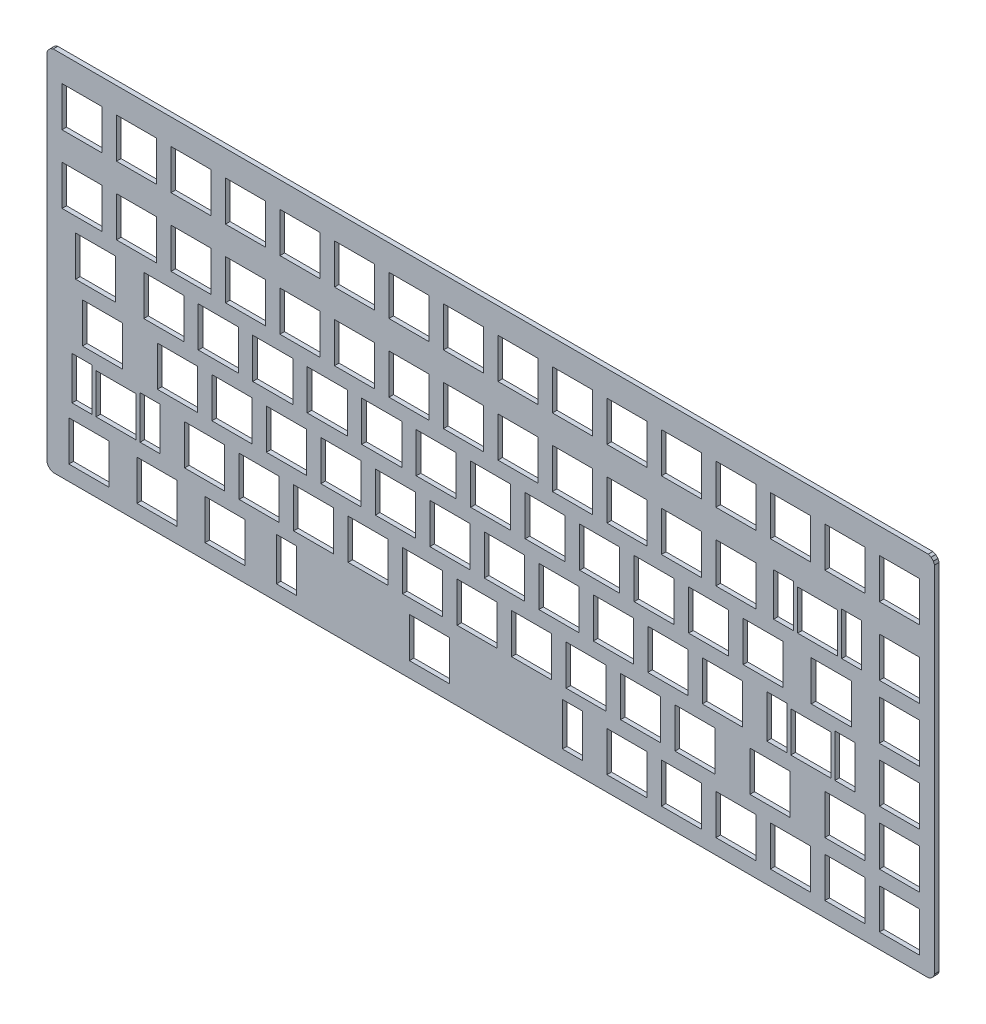
from build123d import *

# Parameters (mm, degrees)
BOSS_EXTRUDE1_DEPTH  = 1.6
SKETCH17_W           = 14
SKETCH17_H           = 14
CUT_EXTRUDE1_DEPTH   = 401.190052506
LPATTERN1_COUNT      = 16
LPATTERN1_PITCH      = 19.05
SKETCH18_W           = 14
SKETCH18_H           = 14
CUT_EXTRUDE2_DEPTH   = 401.190052506
LPATTERN2_COUNT      = 13
LPATTERN2_PITCH      = 19.05
LPATTERN3_COUNT      = 2
LPATTERN3_PITCH      = 257.175
SKETCH20_W           = 14
SKETCH20_H           = 14
CUT_EXTRUDE3_DEPTH   = 401.190052506
SKETCH22_W           = 14
SKETCH22_H           = 14
CUT_EXTRUDE4_DEPTH   = 401.190052506
LPATTERN4_COUNT      = 12
LPATTERN4_PITCH      = 19.05
SKETCH23_W           = 14
SKETCH23_H           = 14
CUT_EXTRUDE5_DEPTH   = 401.190052506
LPATTERN5_COUNT      = 11
LPATTERN5_PITCH      = 19.05
SKETCH24_W           = 14
SKETCH24_H           = 14
CUT_EXTRUDE6_DEPTH   = 401.190052506
LPATTERN6_COUNT      = 10
LPATTERN6_PITCH      = 19.05
SKETCH25_W           = 14
SKETCH25_H           = 14
CUT_EXTRUDE7_DEPTH   = 401.190052506
LPATTERN7_COUNT      = 3
LPATTERN7_PITCH      = 23.8125
SKETCH26_W           = 14
SKETCH26_H           = 14
CUT_EXTRUDE8_DEPTH   = 401.190052506
LPATTERN8_COUNT      = 2
LPATTERN8_PITCH      = 19.05
LPATTERN8_COUNT_DIR2 = 2
LPATTERN8_PITCH_DIR2 = 19.05
SKETCH27_W           = 14
SKETCH27_H           = 14
CUT_EXTRUDE9_DEPTH   = 401.190052506
LPATTERN9_COUNT      = 3
LPATTERN9_PITCH      = 19.05
SKETCH28_W           = 14
SKETCH28_H           = 14
CUT_EXTRUDE10_DEPTH  = 401.190052506
LPATTERN10_COUNT     = 4
LPATTERN10_PITCH     = 19.05
SKETCH29_W           = 14
SKETCH29_H           = 14
CUT_EXTRUDE11_DEPTH  = 401.190052506
LPATTERN11_COUNT     = 2
LPATTERN11_PITCH     = 257.175
SKETCH35_W           = 7
SKETCH35_H           = 15
CUT_EXTRUDE12_DEPTH  = 401.190052506
SKETCH37_W           = 14
SKETCH37_H           = 14
CUT_EXTRUDE13_DEPTH  = 401.190052506
SKETCH38_W           = 14
SKETCH38_H           = 14
CUT_EXTRUDE14_DEPTH  = 401.190052506
SKETCH39_W           = 7
SKETCH39_H           = 15
CUT_EXTRUDE15_DEPTH  = 401.190052506
SKETCH40_W           = 7
SKETCH40_H           = 15
SKETCH40_W_2         = 14
SKETCH40_H_2         = 14
CUT_EXTRUDE16_DEPTH  = 401.190052506
SKETCH41_W           = 14
SKETCH41_H           = 14
CUT_EXTRUDE17_DEPTH  = 401.190052506
SKETCH42_W           = 7
SKETCH42_H           = 15
CUT_EXTRUDE18_DEPTH  = 10


with BuildPart() as part:
    # Sketch14 → Boss-Extrude1 (new body)
    with BuildSketch(Plane.XY):
        Polygon((45.775, -56.546653), (45.778843, -56.507635), (45.790224, -56.470116), (46.170826, -55.551262), (46.189308, -55.516684), (46.214181, -55.486377), (46.961377, -54.73918), (46.991684, -54.714308), (47.026261, -54.695826), (47.945116, -54.315224), (47.982635, -54.303843), (48.021653, -54.3), (353.878347, -54.3), (353.917365, -54.303843), (353.954884, -54.315224), (354.873738, -54.695826), (354.908316, -54.714308), (354.938623, -54.739181), (355.68582, -55.486377), (355.710692, -55.516684), (355.729174, -55.551261), (356.109776, -56.470116), (356.121157, -56.507635), (356.125, -56.546653), (356.125, -180.303347), (356.121157, -180.342365), (356.109776, -180.379884), (355.729174, -181.298739), (355.710692, -181.333316), (355.68582, -181.363623), (354.938623, -182.110819), (354.908316, -182.135692), (354.873738, -182.154174), (353.954884, -182.534776), (353.917365, -182.546157), (353.878347, -182.55), (48.021653, -182.55), (47.982635, -182.546157), (47.945116, -182.534776), (47.026261, -182.154174), (46.991684, -182.135692), (46.961377, -182.11082), (46.214181, -181.363623), (46.189308, -181.333316), (46.170826, -181.298738), (45.790224, -180.379884), (45.778843, -180.342365), (45.775, -180.303347), align=None)
    extrude(amount=BOSS_EXTRUDE1_DEPTH)

    # Sketch17 → Cut-Extrude1 (cut, through all)
    with BuildSketch(Plane.XY.offset(1.6)):
        with Locations((58.072891709, -70.2375)):
            Rectangle(SKETCH17_W, SKETCH17_H)
    cut_extrude1 = extrude(amount=-CUT_EXTRUDE1_DEPTH, mode=Mode.SUBTRACT)

    # LPattern1: Cut-Extrude1 ×16
    with Locations(*[(i * LPATTERN1_PITCH, 0, 0) for i in range(1, LPATTERN1_COUNT)]):
        add(cut_extrude1, mode=Mode.SUBTRACT)

    # Sketch18 → Cut-Extrude2 (cut, through all)
    with BuildSketch(Plane.XY.offset(1.6)):
        with Locations((58.073441718, -94.051507519)):
            Rectangle(SKETCH18_W, SKETCH18_H)
    cut_extrude2 = extrude(amount=-CUT_EXTRUDE2_DEPTH, mode=Mode.SUBTRACT)

    # LPattern2: Cut-Extrude2 ×13
    with Locations(*[(i * LPATTERN2_PITCH, 0, 0) for i in range(1, LPATTERN2_COUNT)]):
        add(cut_extrude2, mode=Mode.SUBTRACT)

    # LPattern3: Cut-Extrude2 ×2
    with Locations(*[(i * LPATTERN3_PITCH, 0, 0) for i in range(1, LPATTERN3_COUNT)]):
        add(cut_extrude2, mode=Mode.SUBTRACT)

    # Sketch20 → Cut-Extrude3 (cut, through all)
    with BuildSketch(Plane.XY.offset(1.6)):
        with Locations((62.831674868, -113.106226091)):
            Rectangle(SKETCH20_W, SKETCH20_H)
    cut_extrude3 = extrude(amount=-CUT_EXTRUDE3_DEPTH, mode=Mode.SUBTRACT)

    # Sketch22 → Cut-Extrude4 (cut, through all)
    with BuildSketch(Plane.XY.offset(1.6)):
        with Locations((86.65, -113.1)):
            Rectangle(SKETCH22_W, SKETCH22_H)
    cut_extrude4 = extrude(amount=-CUT_EXTRUDE4_DEPTH, mode=Mode.SUBTRACT)

    # LPattern4: Cut-Extrude4 ×12
    with Locations(*[(i * LPATTERN4_PITCH, 0, 0) for i in range(1, LPATTERN4_COUNT)]):
        add(cut_extrude4, mode=Mode.SUBTRACT)

    # Sketch23 → Cut-Extrude5 (cut, through all)
    with BuildSketch(Plane.XY.offset(1.6)):
        with Locations((91.4125, -132.15)):
            Rectangle(SKETCH23_W, SKETCH23_H)
    cut_extrude5 = extrude(amount=-CUT_EXTRUDE5_DEPTH, mode=Mode.SUBTRACT)

    # LPattern5: Cut-Extrude5 ×11
    with Locations(*[(i * LPATTERN5_PITCH, 0, 0) for i in range(1, LPATTERN5_COUNT)]):
        add(cut_extrude5, mode=Mode.SUBTRACT)

    # Sketch24 → Cut-Extrude6 (cut, through all)
    with BuildSketch(Plane.XY.offset(1.6)):
        with Locations((100.9375, -151.2)):
            Rectangle(SKETCH24_W, SKETCH24_H)
    cut_extrude6 = extrude(amount=-CUT_EXTRUDE6_DEPTH, mode=Mode.SUBTRACT)

    # LPattern6: Cut-Extrude6 ×10
    with Locations(*[(i * LPATTERN6_PITCH, 0, 0) for i in range(1, LPATTERN6_COUNT)]):
        add(cut_extrude6, mode=Mode.SUBTRACT)

    # Sketch25 → Cut-Extrude7 (cut, through all)
    with BuildSketch(Plane.XY.offset(1.6)):
        with Locations((60.45625, -170.25)):
            Rectangle(SKETCH25_W, SKETCH25_H)
    cut_extrude7 = extrude(amount=-CUT_EXTRUDE7_DEPTH, mode=Mode.SUBTRACT)

    # LPattern7: Cut-Extrude7 ×3
    with Locations(*[(i * LPATTERN7_PITCH, 0, 0) for i in range(1, LPATTERN7_COUNT)]):
        add(cut_extrude7, mode=Mode.SUBTRACT)

    # Sketch26 → Cut-Extrude8 (cut, through all)
    with BuildSketch(Plane.XY.offset(1.6)):
        with Locations((324.775, -151.2)):
            Rectangle(SKETCH26_W, SKETCH26_H)
    cut_extrude8 = extrude(amount=-CUT_EXTRUDE8_DEPTH, mode=Mode.SUBTRACT)

    # LPattern8: Cut-Extrude8 2 × 2
    with Locations(*[(i * LPATTERN8_PITCH, -j * LPATTERN8_PITCH_DIR2, 0) for i in range(LPATTERN8_COUNT) for j in range(LPATTERN8_COUNT_DIR2) if (i, j) != (0, 0)]):
        add(cut_extrude8, mode=Mode.SUBTRACT)

    # Sketch27 → Cut-Extrude9 (cut, through all)
    with BuildSketch(Plane.XY.offset(1.6)):
        with Locations((343.825, -94.05)):
            Rectangle(SKETCH27_W, SKETCH27_H)
    cut_extrude9 = extrude(amount=-CUT_EXTRUDE9_DEPTH, mode=Mode.SUBTRACT)

    # LPattern9: Cut-Extrude9 ×3
    with Locations(*[(0, -i * LPATTERN9_PITCH, 0) for i in range(1, LPATTERN9_COUNT)]):
        add(cut_extrude9, mode=Mode.SUBTRACT)

    # Sketch28 → Cut-Extrude10 (cut, through all)
    with BuildSketch(Plane.XY.offset(1.6)):
        with Locations((248.575, -170.25)):
            Rectangle(SKETCH28_W, SKETCH28_H)
    cut_extrude10 = extrude(amount=-CUT_EXTRUDE10_DEPTH, mode=Mode.SUBTRACT)

    # LPattern10: Cut-Extrude10 ×4
    with Locations(*[(i * LPATTERN10_PITCH, 0, 0) for i in range(1, LPATTERN10_COUNT)]):
        add(cut_extrude10, mode=Mode.SUBTRACT)

    # Sketch29 → Cut-Extrude11 (cut, through all)
    with BuildSketch(Plane.XY.offset(1.6)):
        with Locations((179.51875, -170.25)):
            Rectangle(SKETCH29_W, SKETCH29_H)
    extrude(amount=-CUT_EXTRUDE11_DEPTH, mode=Mode.SUBTRACT)

    # LPattern11: Cut-Extrude3 ×2
    with Locations(*[(i * LPATTERN11_PITCH, 0, 0) for i in range(1, LPATTERN11_COUNT)]):
        add(cut_extrude3, mode=Mode.SUBTRACT)

    # Sketch35 → Cut-Extrude12 (cut, through all)
    with BuildSketch(Plane.XY.offset(1.6)):
        with Locations((129.51875, -169.75)):
            Rectangle(SKETCH35_W, SKETCH35_H)
        with Locations((229.51875, -169.75)):
            Rectangle(SKETCH35_W, SKETCH35_H)
    extrude(amount=-CUT_EXTRUDE12_DEPTH, mode=Mode.SUBTRACT)

    # Sketch37 → Cut-Extrude13 (cut, through all)
    with BuildSketch(Plane.XY.offset(1.6)):
        with Locations((65.21875, -132.15)):
            Rectangle(SKETCH37_W, SKETCH37_H)
    extrude(amount=-CUT_EXTRUDE13_DEPTH, mode=Mode.SUBTRACT)

    # Sketch38 → Cut-Extrude14 (cut, through all)
    with BuildSketch(Plane.XY.offset(1.6)):
        with Locations((69.98125, -151.2)):
            Rectangle(SKETCH38_W, SKETCH38_H)
    extrude(amount=-CUT_EXTRUDE14_DEPTH, mode=Mode.SUBTRACT)

    # Sketch39 → Cut-Extrude15 (cut, through all)
    with BuildSketch(Plane.XY.offset(1.6)):
        with Locations((81.88125, -150.6894482)):
            Rectangle(SKETCH39_W, SKETCH39_H)
        with Locations((58.08125, -150.6894482)):
            Rectangle(SKETCH39_W, SKETCH39_H)
    extrude(amount=-CUT_EXTRUDE15_DEPTH, mode=Mode.SUBTRACT)

    # Sketch40 → Cut-Extrude16 (cut, through all)
    with BuildSketch(Plane.XY.offset(1.6)):
        with Locations((324.76875, -131.65)):
            Rectangle(SKETCH40_W, SKETCH40_H)
        with Locations((312.86875, -132.15)):
            Rectangle(SKETCH40_W_2, SKETCH40_H_2)
        with Locations((300.96875, -131.65)):
            Rectangle(SKETCH40_W, SKETCH40_H)
    extrude(amount=-CUT_EXTRUDE16_DEPTH, mode=Mode.SUBTRACT)

    # Sketch41 → Cut-Extrude17 (cut, through all)
    with BuildSketch(Plane.XY.offset(1.6)):
        with Locations((298.58125, -151.2)):
            Rectangle(SKETCH41_W, SKETCH41_H)
    extrude(amount=-CUT_EXTRUDE17_DEPTH, mode=Mode.SUBTRACT)

    # Sketch42 → Cut-Extrude18 (cut)
    with BuildSketch(Plane.XY.offset(1.6)):
        with Locations((327.148441718, -93.551507519)):
            Rectangle(SKETCH42_W, SKETCH42_H)
        with Locations((303.348441718, -93.551507519)):
            Rectangle(SKETCH42_W, SKETCH42_H)
    extrude(amount=-CUT_EXTRUDE18_DEPTH, mode=Mode.SUBTRACT)


solid = part.part
